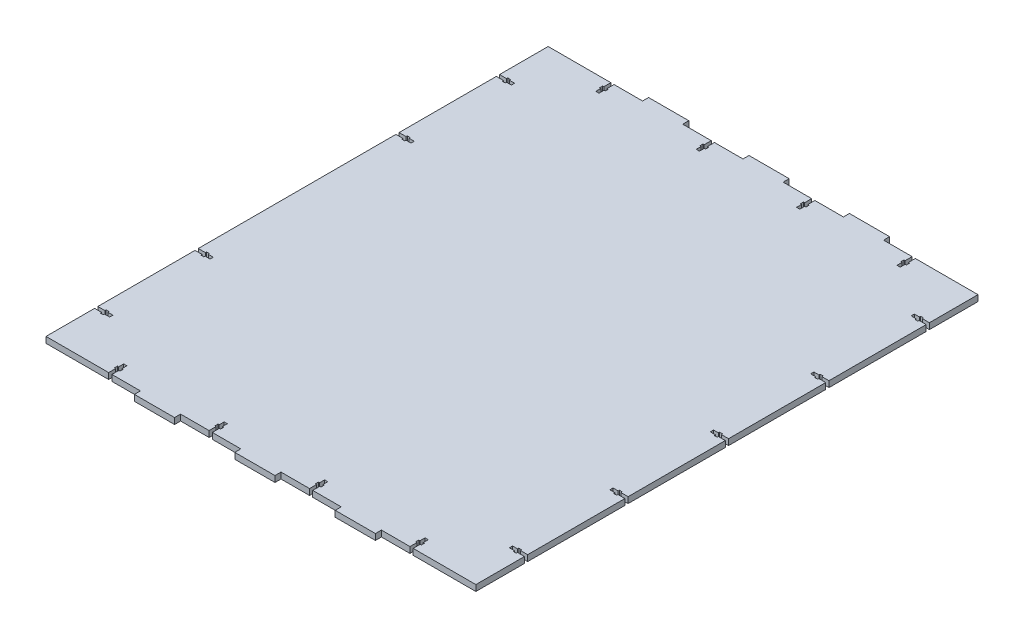
from build123d import *

# Parameters (mm, degrees)
SKETCH1_W           = 428
SKETCH1_H           = 500
BOSS_EXTRUDE1_DEPTH = 6
SKETCH2_W           = 40
SKETCH2_H           = 6
BOSS_EXTRUDE2_DEPTH = 6
CUT_EXTRUDE1_DEPTH  = 334.718444201


with BuildPart() as part:
    # Sketch1 → Boss-Extrude1 (new body)
    with BuildSketch(Plane(origin=(0, 0, 0), x_dir=(1, 0, 0), z_dir=(0, 1, 0))):
        Rectangle(SKETCH1_W, SKETCH1_H)
    extrude(amount=BOSS_EXTRUDE1_DEPTH)

    # Sketch2 → Boss-Extrude2 (add)
    with BuildSketch(Plane.XZ):
        with Locations((-100, 253)):
            Rectangle(SKETCH2_W, SKETCH2_H)
        with Locations((0, 253)):
            Rectangle(SKETCH2_W, SKETCH2_H)
        with Locations((100, 253)):
            Rectangle(SKETCH2_W, SKETCH2_H)
        with Locations((100, -253)):
            Rectangle(SKETCH2_W, SKETCH2_H)
        with Locations((0, -253)):
            Rectangle(SKETCH2_W, SKETCH2_H)
        with Locations((-100, -253)):
            Rectangle(SKETCH2_W, SKETCH2_H)
    extrude(amount=-BOSS_EXTRUDE2_DEPTH)

    # Sketch3 → Cut-Extrude1 (cut, through all)
    with BuildSketch(Plane.XZ):
        Polygon((-151.6, -243), (-151.6, -250), (-148.4, -250), (-148.4, -243), (-147.2, -243), (-147.2, -240), (-148.4, -240), (-148.4, -235), (-151.6, -235), (-151.6, -240), (-152.8, -240), (-152.8, -243), align=None)
        Polygon((-148.4, 250), (-151.6, 250), (-151.6, 243), (-152.8, 243), (-152.8, 240), (-151.6, 240), (-151.6, 235), (-148.4, 235), (-148.4, 240), (-147.2, 240), (-147.2, 243), (-148.4, 243), align=None)
        Polygon((-214, 201.6), (-214, 198.4), (-207, 198.4), (-207, 197.2), (-204, 197.2), (-204, 198.4), (-199, 198.4), (-199, 201.6), (-204, 201.6), (-204, 202.8), (-207, 202.8), (-207, 201.6), align=None)
        Polygon((-214, 101.6), (-214, 98.4), (-207, 98.4), (-207, 97.2), (-204, 97.2), (-204, 98.4), (-199, 98.4), (-199, 101.6), (-204, 101.6), (-204, 102.8), (-207, 102.8), (-207, 101.6), align=None)
        Polygon((-214, -98.4), (-214, -101.6), (-207, -101.6), (-207, -102.8), (-204, -102.8), (-204, -101.6), (-199, -101.6), (-199, -98.4), (-204, -98.4), (-204, -97.2), (-207, -97.2), (-207, -98.4), align=None)
        Polygon((-204, -201.6), (-199, -201.6), (-199, -198.4), (-204, -198.4), (-204, -197.2), (-207, -197.2), (-207, -198.4), (-214, -198.4), (-214, -201.6), (-207, -201.6), (-207, -202.8), (-204, -202.8), align=None)
        Polygon((151.6, 243), (151.6, 250), (148.4, 250), (148.4, 243), (147.2, 243), (147.2, 240), (148.4, 240), (148.4, 235), (151.6, 235), (151.6, 240), (152.8, 240), (152.8, 243), align=None)
        Polygon((148.4, -250), (151.6, -250), (151.6, -243), (152.8, -243), (152.8, -240), (151.6, -240), (151.6, -235), (148.4, -235), (148.4, -240), (147.2, -240), (147.2, -243), (148.4, -243), align=None)
        Polygon((214, -201.6), (214, -198.4), (207, -198.4), (207, -197.2), (204, -197.2), (204, -198.4), (199, -198.4), (199, -201.6), (204, -201.6), (204, -202.8), (207, -202.8), (207, -201.6), align=None)
        Polygon((214, -101.6), (214, -98.4), (207, -98.4), (207, -97.2), (204, -97.2), (204, -98.4), (199, -98.4), (199, -101.6), (204, -101.6), (204, -102.8), (207, -102.8), (207, -101.6), align=None)
        Polygon((214, -1.6), (214, 1.6), (207, 1.6), (207, 2.8), (204, 2.8), (204, 1.6), (199, 1.6), (199, -1.6), (204, -1.6), (204, -2.8), (207, -2.8), (207, -1.6), align=None)
        Polygon((214, 98.4), (214, 101.6), (207, 101.6), (207, 102.8), (204, 102.8), (204, 101.6), (199, 101.6), (199, 98.4), (204, 98.4), (204, 97.2), (207, 97.2), (207, 98.4), align=None)
        Polygon((204, 202.8), (204, 201.6), (199, 201.6), (199, 198.4), (204, 198.4), (204, 197.2), (207, 197.2), (207, 198.4), (214, 198.4), (214, 201.6), (207, 201.6), (207, 202.8), align=None)
        Polygon((-48.4, -235), (-51.6, -235), (-51.6, -240), (-52.8, -240), (-52.8, -243), (-51.6, -243), (-51.6, -250), (-48.4, -250), (-48.4, -243), (-47.2, -243), (-47.2, -240), (-48.4, -240), align=None)
        Polygon((51.6, -235), (48.4, -235), (48.4, -240), (47.2, -240), (47.2, -243), (48.4, -243), (48.4, -250), (51.6, -250), (51.6, -243), (52.8, -243), (52.8, -240), (51.6, -240), align=None)
        Polygon((51.6, 235), (51.6, 240), (52.8, 240), (52.8, 243), (51.6, 243), (51.6, 250), (48.4, 250), (48.4, 243), (47.2, 243), (47.2, 240), (48.4, 240), (48.4, 235), align=None)
        Polygon((-48.4, 235), (-48.4, 240), (-47.2, 240), (-47.2, 243), (-48.4, 243), (-48.4, 250), (-51.6, 250), (-51.6, 243), (-52.8, 243), (-52.8, 240), (-51.6, 240), (-51.6, 235), align=None)
    extrude(amount=-CUT_EXTRUDE1_DEPTH, mode=Mode.SUBTRACT)


solid = part.part
